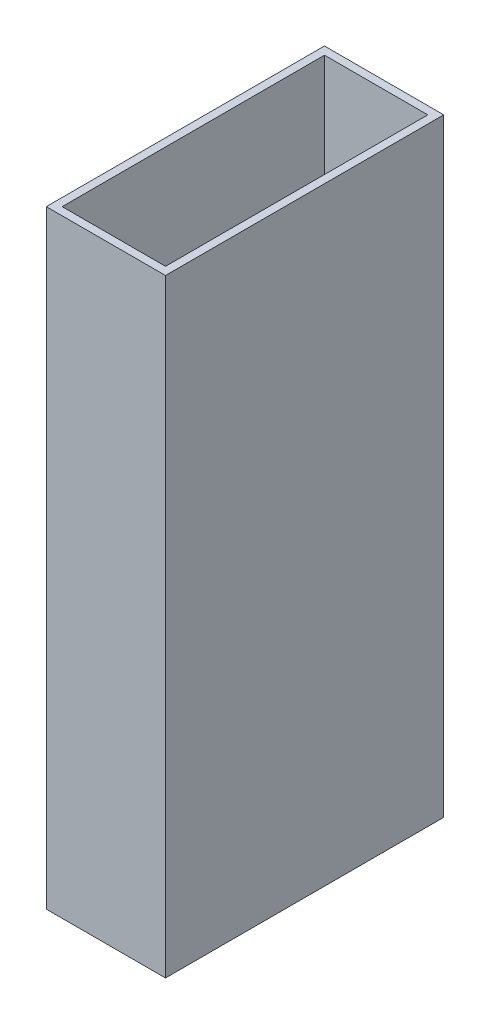
from build123d import *

# Parameters (mm, degrees)
SKETCH_1_W          = 30
SKETCH_1_H          = 750
EXTRUDE_2_DEPTH     = 70
SKETCH_2_W          = 26
SKETCH_2_H          = 66
CUT_EXTRUDE_3_DEPTH = 754.408919512
SKETCH_3_W          = 30
SKETCH_3_H          = 616.866750841
CUT_EXTRUDE_4_DEPTH = 382.772183376


with BuildPart() as part:
    # 草图1 → 凸台-拉伸2 (new body)
    with BuildSketch(Plane.XY):
        Rectangle(SKETCH_1_W, SKETCH_1_H)
    extrude(amount=EXTRUDE_2_DEPTH)

    # 草图2 → 切除-拉伸3 (cut, through all)
    with BuildSketch(Plane.XZ.offset(375)):
        with Locations((0, 35)):
            Rectangle(SKETCH_2_W, SKETCH_2_H)
    extrude(amount=-CUT_EXTRUDE_3_DEPTH, mode=Mode.SUBTRACT)

    # 草图3 → 切除-拉伸4 (cut, through all)
    with BuildSketch(Plane.XY.offset(70)):
        with Locations((0, -86.503375421)):
            Rectangle(SKETCH_3_W, SKETCH_3_H)
    extrude(amount=-CUT_EXTRUDE_4_DEPTH, mode=Mode.SUBTRACT)


solid = part.part
